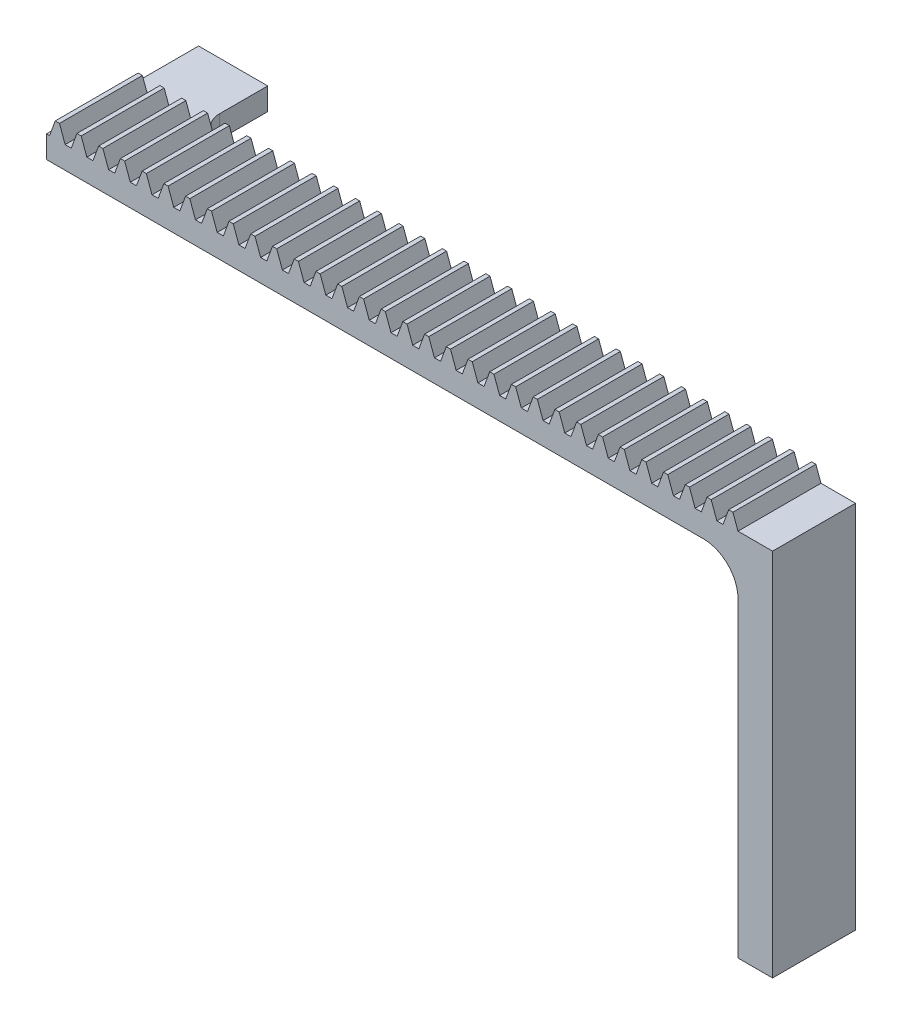
from build123d import *

# Parameters (mm, degrees)
BLANKSKE_W          = 100
BLANKSKE_H          = 11
BLANK_DEPTH         = 12
TOOTHCUTSIM_DEPTH   = 102.316336294
TEETHCUTS_COUNT     = 33
TEETHCUTS_PITCH     = 3.14159265
SKETCH1_W           = 12
SKETCH1_H           = 5.53
CUT_EXTRUDE1_DEPTH  = 126
SKETCH2_W           = 12
SKETCH2_H           = 3.457737656
BOSS_EXTRUDE1_DEPTH = 5
SKETCH3_W           = 5
SKETCH3_H           = 12
BOSS_EXTRUDE2_DEPTH = 50
FILLET1_R           = 5
SKETCH4_W           = 10
SKETCH4_H           = 3.22
BOSS_EXTRUDE3_DEPTH = 10
FILLET2_R           = 3


with BuildPart() as part:
    # BlankSke → Blank (new body)
    with BuildSketch(Plane.XY):
        with Locations((50, 5.5)):
            Rectangle(BLANKSKE_W, BLANKSKE_H)
    extrude(amount=-BLANK_DEPTH)

    # TooCutSkeSim → ToothCutSim (cut, through all)
    with BuildSketch(Plane.XY):
        Polygon((0.44443537, 8.75), (-0.44443537, 8.75), (-1.272613241, 11.0254), (1.272613241, 11.0254), align=None)
    toothcutsim = extrude(amount=-TOOTHCUTSIM_DEPTH, mode=Mode.SUBTRACT)

    # TeethCuts: ToothCutSim ×33
    with Locations(*[(i * TEETHCUTS_PITCH, 0, 0) for i in range(1, TEETHCUTS_COUNT)]):
        add(toothcutsim, mode=Mode.SUBTRACT)

    # Sketch1 → Cut-Extrude1 (cut)
    with BuildSketch(Plane(origin=(100, 0, 0), x_dir=(0, 0, -1), z_dir=(1, 0, 0))):
        with Locations((6, 2.765)):
            Rectangle(SKETCH1_W, SKETCH1_H)
    extrude(amount=-CUT_EXTRUDE1_DEPTH, mode=Mode.SUBTRACT)

    # Sketch2 → Boss-Extrude1 (add)
    with BuildSketch(Plane(origin=(100, 0, 0), x_dir=(0, 0, -1), z_dir=(1, 0, 0))):
        with Locations((6, 7.258868828)):
            Rectangle(SKETCH2_W, SKETCH2_H)
    extrude(amount=BOSS_EXTRUDE1_DEPTH)

    # Sketch3 → Boss-Extrude2 (add)
    with BuildSketch(Plane.XZ.offset(-5.53)):
        with Locations((102.5, -6)):
            Rectangle(SKETCH3_W, SKETCH3_H)
    extrude(amount=BOSS_EXTRUDE2_DEPTH)

    # Fillet1
    fillet1_edges = [part.edges().sort_by_distance(p)[0] for p in [
        (100, 5.53, -6),
    ]]
    fillet(fillet1_edges, radius=FILLET1_R)

    # Sketch4 → Boss-Extrude3 (add)
    with BuildSketch(Plane(origin=(0, 0, -12), x_dir=(-1, 0, 0), z_dir=(0, 0, -1))):
        with Locations((-5, 7.14)):
            Rectangle(SKETCH4_W, SKETCH4_H)
    extrude(amount=BOSS_EXTRUDE3_DEPTH)

    # Fillet2
    # the kernel refuses this fillet: 3 mm, written as the material it adds along each edge
    with BuildSketch(Plane(origin=(10, 5.53, -12), x_dir=(1, 0, 0), z_dir=(0, 1, 0))) as fillet2_piece_1:
        with BuildLine():
            CenterArc((FILLET2_R, FILLET2_R), FILLET2_R, 180, 90)
            Line((0, FILLET2_R), (0, 0))
            Line((0, 0), (FILLET2_R, 0))
        make_face()
    extrude(amount=3.22)


solid = part.part
